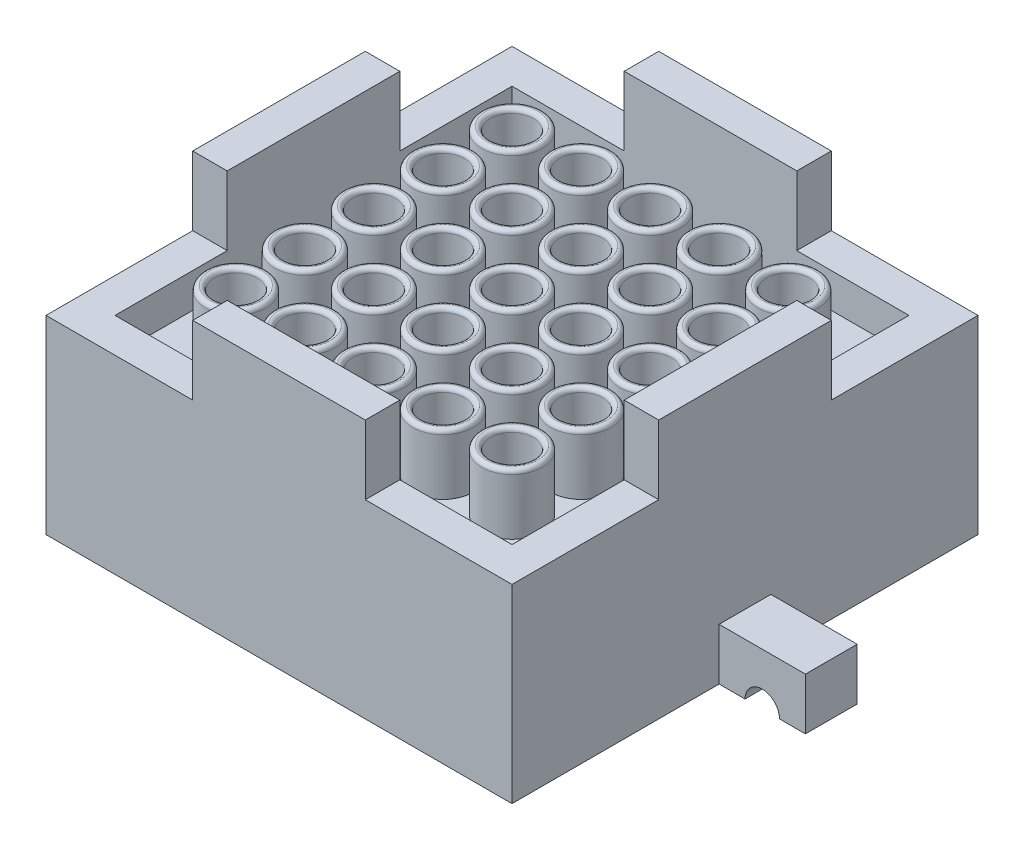
from build123d import *

# Parameters (mm, degrees)
SKETCH1_W              = 27
SKETCH1_H              = 27
SKETCH1_W_2            = 23
SKETCH1_H_2            = 23
BOSS_EXTRUDE1_DEPTH    = 2
SKETCH2_W              = 27
SKETCH2_H              = 27
BOSS_EXTRUDE2_DEPTH    = 2
SKETCH3_W              = 27
SKETCH3_H              = 27
SKETCH3_W_2            = 23
SKETCH3_H_2            = 23
BOSS_EXTRUDE3_DEPTH    = 5
SKETCH6_R              = 1.75
BOSS_EXTRUDE5_DEPTH    = 3.5
CUT_EXTRUDE2_REACH     = 23.789
SKETCH7_R              = 1.25
FILLET1_R              = 0.25
LPATTERN3_COUNT        = 5
LPATTERN3_PITCH        = 4
LPATTERN3_COUNT_DIR2   = 5
LPATTERN3_PITCH_DIR2   = 4
FILLET1_OF_LPATTERN3_R = 0.25
SKETCH11_R             = 0.75
BOSS_EXTRUDE8_DEPTH    = 5
LPATTERN2_COUNT        = 6
LPATTERN2_PITCH        = 4
LPATTERN2_COUNT_DIR2   = 6
LPATTERN2_PITCH_DIR2   = 4
SKETCH8_W              = 27
SKETCH8_H              = 27
BOSS_EXTRUDE6_DEPTH    = 2
SKETCH9_R              = 4.25
CUT_EXTRUDE3_DEPTH     = 7
SKETCH10_W             = 2
SKETCH10_H             = 10
BOSS_EXTRUDE7_DEPTH    = 4
CIRPATTERN2_COUNT      = 4
SKETCH12_W             = 3
SKETCH12_H             = 3
BOSS_EXTRUDE9_DEPTH    = 5
CIRPATTERN1_COUNT      = 2
CUT_EXTRUDE4_REACH     = 27.461


with BuildPart() as part:
    # Sketch1 → Boss-Extrude1 (new body)
    with BuildSketch(Plane(origin=(0, 0, 0), x_dir=(1, 0, 0), z_dir=(0, 1, 0))):
        Rectangle(SKETCH1_W, SKETCH1_H)
        Rectangle(SKETCH1_W_2, SKETCH1_H_2, mode=Mode.SUBTRACT)
    extrude(amount=BOSS_EXTRUDE1_DEPTH)

    # Sketch2 → Boss-Extrude2 (add)
    with BuildSketch(Plane.XZ):
        Rectangle(SKETCH2_W, SKETCH2_H)
    extrude(amount=BOSS_EXTRUDE2_DEPTH)

    # Sketch3 → Boss-Extrude3 (add)
    with BuildSketch(Plane.XZ.offset(2)):
        Rectangle(SKETCH3_W, SKETCH3_H)
        Rectangle(SKETCH3_W_2, SKETCH3_H_2, mode=Mode.SUBTRACT)
    extrude(amount=BOSS_EXTRUDE3_DEPTH)

    # Sketch6 → Boss-Extrude5 (add)
    with BuildSketch(Plane(origin=(0, 0, 0), x_dir=(1, 0, 0), z_dir=(0, 1, 0))):
        with Locations(Location((8, 8, 0), (0, 0, 90))):
            Circle(SKETCH6_R)
    boss_extrude5 = extrude(amount=BOSS_EXTRUDE5_DEPTH)

    # Sketch7 → Cut-Extrude2 (cut, up to next)
    with BuildSketch(Plane(origin=(0, 3.5, 0), x_dir=(1, 0, 0), z_dir=(0, 1, 0)), mode=Mode.PRIVATE) as cut_extrude2_sk1:
        with Locations(Location((8, 8, 0), (0, 0, 270))):
            Circle(SKETCH7_R)
    cut_extrude2_tool1 = extrude(cut_extrude2_sk1.sketch, amount=-CUT_EXTRUDE2_REACH, mode=Mode.PRIVATE) & part.part
    cut_extrude2 = cut_extrude2_tool1.solids().sort_by_distance((8, 3.5, -8))[0]
    add(cut_extrude2, mode=Mode.SUBTRACT)

    # Fillet1
    fillet1_edges = [part.edges().sort_by_distance(p)[0] for p in [
        (8, 3.5, -6.25),
        (8, 3.5, -9.25),
    ]]
    fillet(fillet1_edges, radius=FILLET1_R - 0.0001)  # a hair under: the kernel refuses the full size

    # LPattern3: Boss-Extrude5, Cut-Extrude2 5 × 5
    with Locations(*[(-j * LPATTERN3_PITCH_DIR2, 0, i * LPATTERN3_PITCH) for i in range(LPATTERN3_COUNT) for j in range(LPATTERN3_COUNT_DIR2) if (i, j) != (0, 0)]):
        add(boss_extrude5)
        add(cut_extrude2, mode=Mode.SUBTRACT)

    # Fillet1 of LPattern3
    fillet1_of_lpattern3_edges = [part.edges().sort_by_distance(p)[0] for p in [
        (4, 3.5, -6.25),
        (4, 3.5, -9.25),
        (0, 3.5, -6.25),
        (0, 3.5, -9.25),
        (-4, 3.5, -6.25),
        (-4, 3.5, -9.25),
        (-8, 3.5, -6.25),
        (-8, 3.5, -9.25),
        (8, 3.5, -2.25),
        (8, 3.5, -5.25),
        (4, 3.5, -2.25),
        (4, 3.5, -5.25),
        (0, 3.5, -2.25),
        (0, 3.5, -5.25),
        (-4, 3.5, -2.25),
        (-4, 3.5, -5.25),
        (-8, 3.5, -2.25),
        (-8, 3.5, -5.25),
        (8, 3.5, 1.75),
        (8, 3.5, -1.25),
        (4, 3.5, 1.75),
        (4, 3.5, -1.25),
        (0, 3.5, 1.75),
        (0, 3.5, -1.25),
        (-4, 3.5, 1.75),
        (-4, 3.5, -1.25),
        (-8, 3.5, 1.75),
        (-8, 3.5, -1.25),
        (8, 3.5, 5.75),
        (8, 3.5, 2.75),
        (4, 3.5, 5.75),
        (4, 3.5, 2.75),
        (0, 3.5, 5.75),
        (0, 3.5, 2.75),
        (-4, 3.5, 5.75),
        (-4, 3.5, 2.75),
        (-8, 3.5, 5.75),
        (-8, 3.5, 2.75),
        (8, 3.5, 9.75),
        (8, 3.5, 6.75),
        (4, 3.5, 9.75),
        (4, 3.5, 6.75),
        (0, 3.5, 9.75),
        (0, 3.5, 6.75),
        (-4, 3.5, 9.75),
        (-4, 3.5, 6.75),
        (-8, 3.5, 9.75),
        (-8, 3.5, 6.75),
    ]]
    fillet(fillet1_of_lpattern3_edges, radius=FILLET1_OF_LPATTERN3_R - 0.0001)  # a hair under: the kernel refuses the full size

    # Sketch11 → Boss-Extrude8 (add)
    with BuildSketch(Plane.XZ.offset(2)):
        with Locations(Location((-9.9, 9.9, 0), (0, 0, 90))):
            Circle(SKETCH11_R)
    boss_extrude8 = extrude(amount=BOSS_EXTRUDE8_DEPTH)

    # LPattern2: Boss-Extrude8 6 × 6
    with Locations(*[(i * LPATTERN2_PITCH, 0, -j * LPATTERN2_PITCH_DIR2) for i in range(LPATTERN2_COUNT) for j in range(LPATTERN2_COUNT_DIR2) if (i, j) != (0, 0)]):
        add(boss_extrude8)

    # Sketch8 → Boss-Extrude6 (add)
    with BuildSketch(Plane.XZ.offset(7)):
        Rectangle(SKETCH8_W, SKETCH8_H)
    extrude(amount=BOSS_EXTRUDE6_DEPTH)

    # Sketch9 → Cut-Extrude3 (cut)
    with BuildSketch(Plane.XZ.offset(9)):
        with Locations(Location((0, 0, 0), (0, 0, 270))):
            Circle(SKETCH9_R)
    extrude(amount=-CUT_EXTRUDE3_DEPTH, mode=Mode.SUBTRACT)

    # Sketch10 → Boss-Extrude7 (add)
    with BuildSketch(Plane(origin=(0, 2, 0), x_dir=(1, 0, 0), z_dir=(0, 1, 0))):
        with Locations((-12.5, 0)):
            Rectangle(SKETCH10_W, SKETCH10_H)
    boss_extrude7 = extrude(amount=BOSS_EXTRUDE7_DEPTH)

    # CirPattern2: Boss-Extrude7 ×4 about axis
    cirpattern2_axis = Axis((0, 0, 0), (0, 1, 0))
    for i in range(1, CIRPATTERN2_COUNT):
        add(boss_extrude7.rotate(cirpattern2_axis, i * 360 / CIRPATTERN2_COUNT))

    # Sketch12 → Boss-Extrude9 (add)
    with BuildSketch(Plane.ZY.offset(13.5)):
        with Locations((0, -7.5)):
            Rectangle(SKETCH12_W, SKETCH12_H)
    boss_extrude9 = extrude(amount=BOSS_EXTRUDE9_DEPTH)

    # CirPattern1: Boss-Extrude9 ×2 about axis
    cirpattern1_axis = Axis((0, 0, 0), (0, 1, 0))
    for i in range(1, CIRPATTERN1_COUNT):
        add(boss_extrude9.rotate(cirpattern1_axis, i * 360 / CIRPATTERN1_COUNT))

    # Sketch13 → Cut-Extrude4 (cut, up to next)
    with BuildSketch(Plane.XY.offset(1.5), mode=Mode.PRIVATE) as cut_extrude4_sk1:
        with BuildLine():
            Line((15, -9), (17, -9))
            ThreePointArc((17, -9), (16, -8), (15, -9))
        make_face()
    cut_extrude4_tool1 = extrude(cut_extrude4_sk1.sketch, amount=-CUT_EXTRUDE4_REACH, mode=Mode.PRIVATE) & part.part
    # Sketch13 → Cut-Extrude4 (cut, up to next)
    with BuildSketch(Plane.XY.offset(1.5), mode=Mode.PRIVATE) as cut_extrude4_sk2:
        with BuildLine():
            Line((-17, -9), (-15, -9))
            ThreePointArc((-15, -9), (-16, -8), (-17, -9))
        make_face()
    cut_extrude4_tool2 = extrude(cut_extrude4_sk2.sketch, amount=-CUT_EXTRUDE4_REACH, mode=Mode.PRIVATE) & part.part
    add(cut_extrude4_tool1.solids().sort_by_distance((16, -8.575587, 1.5))[0], mode=Mode.SUBTRACT)
    add(cut_extrude4_tool2.solids().sort_by_distance((-16, -8.575587, 1.5))[0], mode=Mode.SUBTRACT)


solid = part.part
